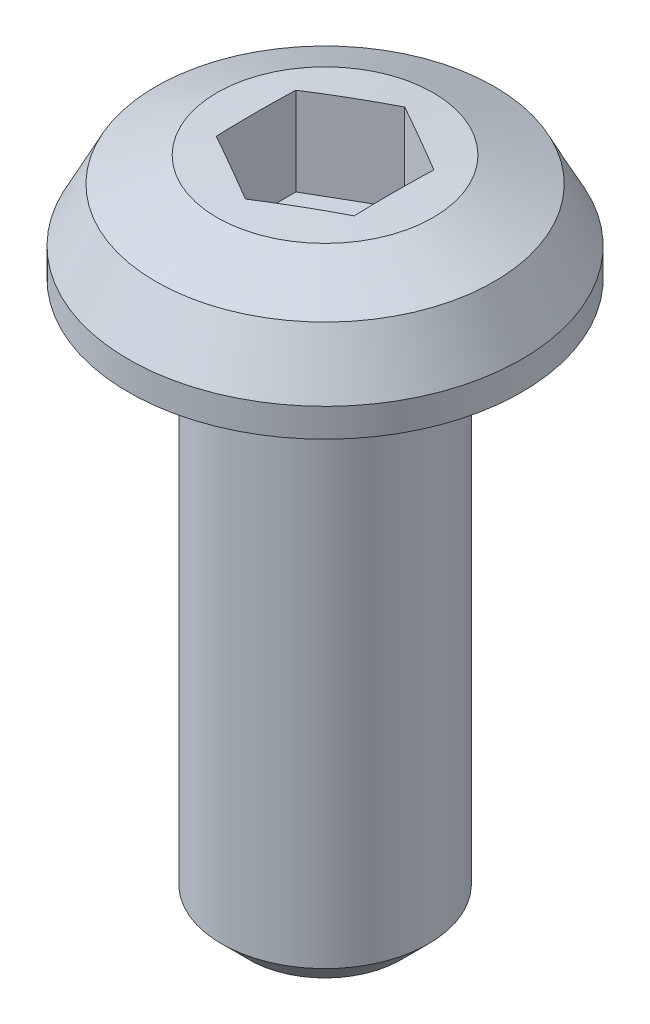
from build123d import *

# Parameters (mm, degrees)
CUT_EXTRUDE1_DEPTH = 1.35


with BuildPart() as part:
    # Sketch1 → Revolve1 (revolve)
    with BuildSketch(Plane.XY):
        Polygon((0, -8), (1.1, -8), (1.5, -7.6), (1.5, 0), (2.85, 0), (2.85, 0.4125), (2.451, 1.188), (1.5675, 1.551), (0, 1.65), align=None)
    revolve(axis=Axis((0, -10, 0), (0, 1, 0)))

    # Sketch2 → Cut-Extrude1 (cut)
    with BuildSketch(Plane(origin=(0, 1.65, 0), x_dir=(1, 0, 0), z_dir=(0, 1, 0))):
        Polygon((1, -0.577350269), (0, -1.154700538), (-1, -0.577350269), (-1, 0.577350269), (0, 1.154700538), (1, 0.577350269), align=None)
    extrude(amount=-CUT_EXTRUDE1_DEPTH, mode=Mode.SUBTRACT)


solid = part.part
